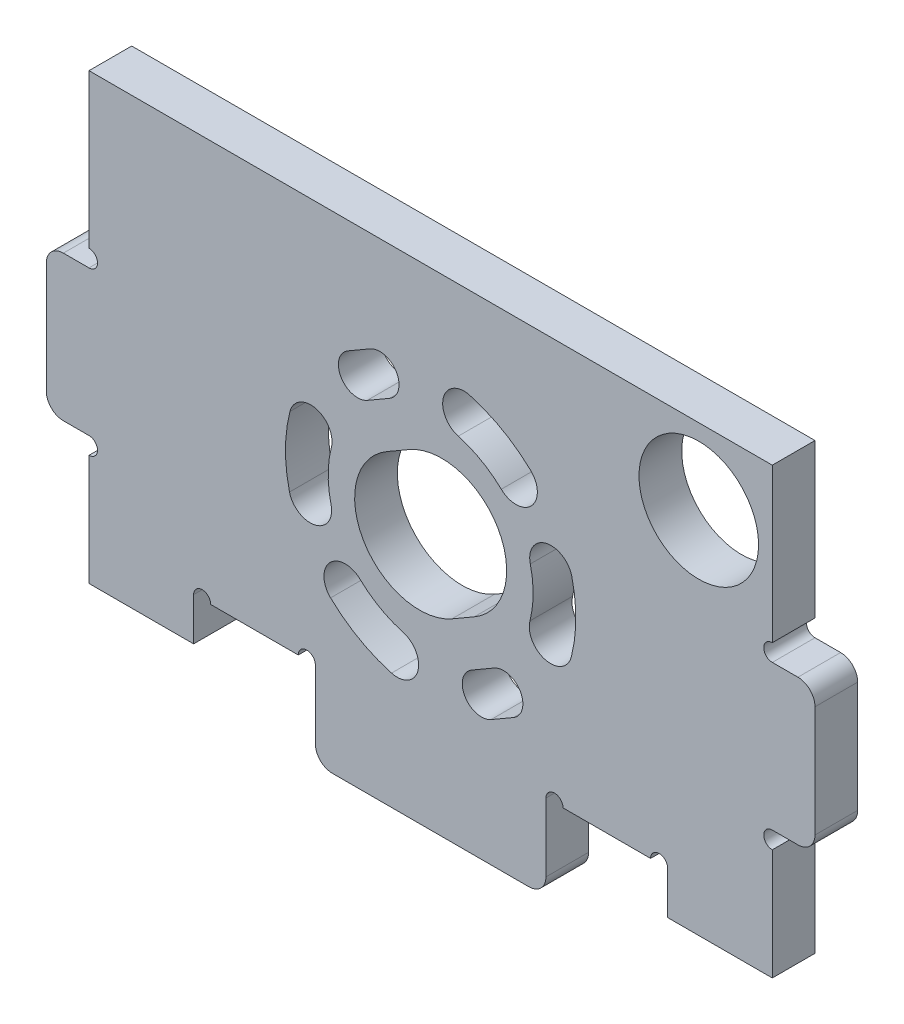
from build123d import *

# Parameters (mm, degrees)
SKETCH_1_W          = 80
SKETCH_1_H          = 52
EXTRUDE_1_DEPTH     = 5
CUT_EXTRUDE_1_DEPTH = 5
SKETCH_3_R          = 7
CUT_EXTRUDE_2_DEPTH = 10
SKETCH_10_W         = 27
SKETCH_10_H         = 5
SKETCH_10_W_2       = 5
SKETCH_10_H_2       = 17
EXTRUDE_3_DEPTH     = 5
SKETCH_11_R         = 1
CUT_EXTRUDE_5_DEPTH = 5
FILLET_1_R          = 2
SKETCH_12_W         = 14.25
SKETCH_12_H         = 5
CUT_EXTRUDE_6_DEPTH = 10
SKETCH_15_R         = 1
CUT_EXTRUDE_7_DEPTH = 10


with BuildPart() as part:
    # 스케치1 → 보스-돌출1 (new body)
    with BuildSketch(Plane.XY):
        with Locations((-2.598076211, 25)):
            Rectangle(SKETCH_1_W, SKETCH_1_H)
        with BuildLine():
            Line((-7.697114317, 29.831793069), (-5.099038106, 31.331793069))
            ThreePointArc((-5.099038106, 31.331793069), (5.282754963, 28.55), (2.500961894, 18.168206931))
            Line((2.500961894, 18.168206931), (-0.097114317, 16.668206931))
            ThreePointArc((-0.097114317, 16.668206931), (-10.478907386, 19.45), (-7.697114317, 29.831793069))
        make_face(mode=Mode.SUBTRACT)
        with BuildLine():
            ThreePointArc((9.118681917, 36.317368995), (5.799069268, 38.781337822), (1.982863658, 40.371163365))
            ThreePointArc((1.982863658, 40.371163365), (-1.098327994, 38.637306968), (0.635528403, 35.556115316))
            ThreePointArc((0.635528403, 35.556115316), (3.329320598, 34.433885521), (5.672576585, 32.694613408))
            ThreePointArc((5.672576585, 32.694613408), (9.207007044, 32.782938536), (9.118681917, 36.317368995))
        make_face(mode=Mode.SUBTRACT)
        with BuildLine():
            ThreePointArc((13.92745731, 27.988325692), (14.401510584, 23.881472394), (13.870237087, 19.781628618))
            ThreePointArc((13.870237087, 19.781628618), (10.828077575, 17.980166572), (9.026615528, 21.022326083))
            ThreePointArc((9.026615528, 21.022326083), (9.401632115, 23.916333454), (9.067006275, 26.815288723))
            ThreePointArc((9.067006275, 26.815288723), (10.910713308, 29.832032725), (13.92745731, 27.988325692))
        make_face(mode=Mode.SUBTRACT)
        with BuildLine():
            ThreePointArc((-14.31483434, 11.682631005), (-10.995221691, 9.218662178), (-7.179016081, 7.628836635))
            ThreePointArc((-7.179016081, 7.628836635), (-4.097824429, 9.362693032), (-5.831680825, 12.443884684))
            ThreePointArc((-5.831680825, 12.443884684), (-8.52547302, 13.566114479), (-10.868729008, 15.305386592))
            ThreePointArc((-10.868729008, 15.305386592), (-14.403159467, 15.217061464), (-14.31483434, 11.682631005))
        make_face(mode=Mode.SUBTRACT)
        with BuildLine():
            ThreePointArc((-19.123609733, 20.011674308), (-19.597663007, 24.118527606), (-19.066389509, 28.218371382))
            ThreePointArc((-19.066389509, 28.218371382), (-16.024229998, 30.019833428), (-14.222767951, 26.977673917))
            ThreePointArc((-14.222767951, 26.977673917), (-14.597784537, 24.083666546), (-14.263158697, 21.184711277))
            ThreePointArc((-14.263158697, 21.184711277), (-16.106865731, 18.167967275), (-19.123609733, 20.011674308))
        make_face(mode=Mode.SUBTRACT)
    extrude(amount=EXTRUDE_1_DEPTH)

    # 스케치2 → 컷-돌출1 (cut)
    with BuildSketch(Plane.XY.offset(5)):
        with BuildLine():
            Line((7.075961894, 10.244074487), (4.477885683, 8.744074487))
            ThreePointArc((4.477885683, 8.744074487), (1.404328524, 9.567631645), (2.227885683, 12.641188804))
            Line((2.227885683, 12.641188804), (4.825961894, 14.141188804))
            ThreePointArc((4.825961894, 14.141188804), (7.899519053, 13.317631645), (7.075961894, 10.244074487))
        make_face()
        with BuildLine():
            Line((-7.424038106, 35.358811196), (-10.022114317, 33.858811196))
            ThreePointArc((-10.022114317, 33.858811196), (-13.095671476, 34.682368355), (-12.272114317, 37.755925513))
            Line((-12.272114317, 37.755925513), (-9.674038106, 39.255925513))
            ThreePointArc((-9.674038106, 39.255925513), (-6.600480947, 38.432368355), (-7.424038106, 35.358811196))
        make_face()
    extrude(amount=-CUT_EXTRUDE_1_DEPTH, mode=Mode.SUBTRACT)

    # 스케치3 → 컷-돌출2 (cut)
    with BuildSketch(Plane.XY.offset(5)):
        with Locations((28.795344676, 42.125)):
            Circle(SKETCH_3_R)
    extrude(amount=-CUT_EXTRUDE_2_DEPTH, mode=Mode.SUBTRACT)

    # 스케치10 → 보스-돌출3 (add)
    with BuildSketch(Plane.XY.offset(5)):
        with Locations((-2.598076211, -3.5)):
            Rectangle(SKETCH_10_W, SKETCH_10_H)
        with Locations((39.901923789, 22.5)):
            Rectangle(SKETCH_10_W_2, SKETCH_10_H_2)
        with Locations((-45.098076211, 22.5)):
            Rectangle(SKETCH_10_W_2, SKETCH_10_H_2)
    extrude(amount=-EXTRUDE_3_DEPTH)

    # 스케치11 → 컷-돌출5 (cut)
    with BuildSketch(Plane.XY.offset(5)):
        with Locations((37.401923789, 32)):
            Circle(SKETCH_11_R)
        with Locations((37.401923789, 13)):
            Circle(SKETCH_11_R)
        with Locations((-42.598076211, 13)):
            Circle(SKETCH_11_R)
        with Locations((-42.598076211, 32)):
            Circle(SKETCH_11_R)
        with Locations((11.901923789, -1)):
            Circle(SKETCH_11_R)
        with Locations((-17.098076211, -1)):
            Circle(SKETCH_11_R)
    extrude(amount=-CUT_EXTRUDE_5_DEPTH, mode=Mode.SUBTRACT)

    # 필렛1
    fillet_1_edges = [part.edges().sort_by_distance(p)[0] for p in [
        (42.401923789, 31, 2.5),
        (42.401923789, 14, 2.5),
        (10.901923789, -6, 2.5),
        (-16.098076211, -6, 2.5),
        (-47.598076211, 14, 2.5),
        (-47.598076211, 31, 2.5),
    ]]
    fillet(fillet_1_edges, radius=FILLET_1_R)

    # 스케치12 → 컷-돌출6 (cut)
    with BuildSketch(Plane.XY.offset(5)):
        with Locations((18.026923789, 1.5)):
            Rectangle(SKETCH_12_W, SKETCH_12_H)
        with Locations((-23.223076211, 1.5)):
            Rectangle(SKETCH_12_W, SKETCH_12_H)
    extrude(amount=-CUT_EXTRUDE_6_DEPTH, mode=Mode.SUBTRACT)

    # 스케치15 → 컷-돌출7 (cut)
    with BuildSketch(Plane.XY.offset(5)):
        with Locations((11.901923789, 4)):
            Circle(SKETCH_15_R)
        with Locations((24.151923789, 4)):
            Circle(SKETCH_15_R)
        with Locations((-17.098076211, 4)):
            Circle(SKETCH_15_R)
        with Locations((-29.348076211, 4)):
            Circle(SKETCH_15_R)
    extrude(amount=-CUT_EXTRUDE_7_DEPTH, mode=Mode.SUBTRACT)


solid = part.part
